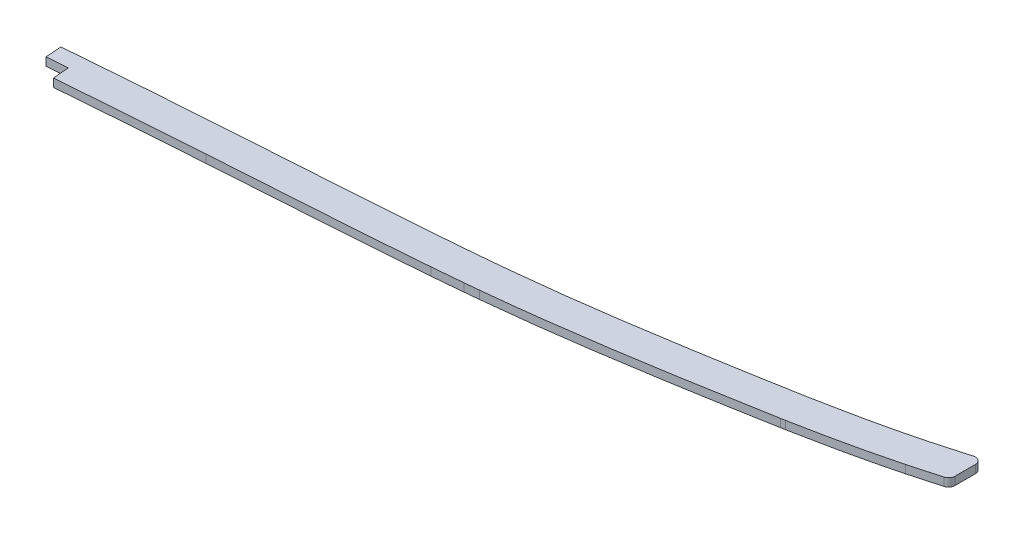
from build123d import *

# Parameters (mm, degrees)
BOSS_EXTRUDE1_START = -1.5875
BOSS_EXTRUDE1_DEPTH = 3.175
FILLET1_R           = 2.54
CUT_EXTRUDE1_DEPTH  = 7.62


# Read off the part's stored shape, not the designer's step: Boss-Extrude1
with BuildPart() as part:
    # Boss-Extrude1 outline → Boss-Extrude1 (new body)
    with BuildSketch(Plane(origin=(0, 0, 0), x_dir=(1, 0, 0), z_dir=(0, 1, 0)).offset(BOSS_EXTRUDE1_START)):
        with BuildLine():
            add(Edge.make_bspline(
                [(701.573370465, -71.674259434), (702.04697488, -71.626796619), (702.961854911, -71.534187022), (704.527211696, -71.372087014), (706.256268563, -71.189411511), (708.433468196, -70.954566837), (711.038260137, -70.66442021), (715.259153852, -70.176918919), (720.517449562, -69.537326192), (728.939784684, -68.449094171), (739.471043309, -66.973596397), (752.121699379, -65.058370184), (764.774270693, -63.022725712), (775.332382372, -61.245644149), (783.768221701, -59.789793136), (790.217423582, -58.659365862), (795.556531692, -57.710632329), (799.706029598, -56.965839367), (801.743713725, -56.597532565), (802.76701547, -56.411910209)],
                knots=[1.1996e-05, 1.1996e-05, 1.1996e-05, 1.1996e-05, 0.015636808, 0.031261621, 0.046886433, 0.062511246, 0.093760871, 0.125010496, 0.187509746, 0.250008997, 0.375007497, 0.500005998, 0.625004498, 0.750002999, 0.812502249, 0.875001499, 0.93750075, 0.968750375, 1, 1, 1, 1], degree=3))
            add(Edge.make_bspline(
                [(696.057912544, -72.218303811), (696.516819195, -72.173843609), (697.434189716, -72.08448281), (698.812500771, -71.948951554), (700.191895387, -71.812223809), (701.113019016, -71.720314305), (701.573370465, -71.674259434)],
                knots=[0.000436824, 0.000436824, 0.000436824, 0.000436824, 0.250279009, 0.500121194, 0.749963378, 0.999805563, 0.999805563, 0.999805563, 0.999805563], degree=3))
            add(Edge.make_bspline(
                [(684.465771861, -73.258588893), (685.427037387, -73.178353817), (687.338409796, -73.01607439), (690.270265001, -72.757917882), (693.135698373, -72.496722872), (695.087462196, -72.311946881), (696.057912544, -72.218303811)],
                knots=[-3.996e-06, -3.996e-06, -3.996e-06, -3.996e-06, 0.249945754, 0.499895504, 0.749845254, 0.999795004, 0.999795004, 0.999795004, 0.999795004], degree=3))
            add(Edge.make_bspline(
                [(602.42420841, -79.030202072), (604.074214061, -78.917973041), (607.327656264, -78.697993222), (612.488020924, -78.352754528), (617.82142797, -77.998720132), (624.748165187, -77.541006681), (633.288768179, -76.978079707), (643.562499486, -76.293021789), (653.811394813, -75.590339748), (662.341271598, -74.981221252), (669.157253218, -74.473896148), (673.963588211, -74.106706625), (678.141033863, -73.776630779), (681.719672317, -73.486306526), (683.554235836, -73.334679882), (684.465771861, -73.258588893)],
                knots=[4.679e-06, 4.679e-06, 4.679e-06, 4.679e-06, 0.062504419, 0.125004159, 0.1875039, 0.25000364, 0.375003121, 0.500002601, 0.625002082, 0.750001563, 0.812501303, 0.875001043, 0.937500783, 0.968750654, 1.000000524, 1.000000524, 1.000000524, 1.000000524], degree=3))
            add(Edge.make_bspline(
                [(520.17866376, -85.310815783), (520.948622537, -85.247475703), (522.472990474, -85.121954498), (525.646023872, -84.860432492), (529.954540392, -84.505420462), (535.485636827, -84.050761487), (540.7029418, -83.623505808), (545.828810606, -83.207047886), (550.972711882, -82.793890253), (556.116782859, -82.386921041), (562.976897794, -81.853433898), (571.571389273, -81.203899916), (581.568137842, -80.474939815), (590.024015055, -79.880194977), (597.052441707, -79.396103056), (600.639671821, -79.151478022), (602.42420841, -79.030202072)],
                knots=[1.3823e-05, 1.3823e-05, 1.3823e-05, 1.3823e-05, 0.031263258, 0.062512694, 0.125011564, 0.187510435, 0.250009305, 0.312508176, 0.375007046, 0.437505917, 0.500004787, 0.625002528, 0.750000269, 0.87499801, 0.937496881, 0.999995751, 0.999995751, 0.999995751, 0.999995751], degree=3))
            add(Edge.make_bspline(
                [(421.564796931, -90.347249187), (422.61109619, -90.324190198), (424.721066812, -90.275643156), (427.781390104, -90.199626606), (430.822063258, -90.118782847), (434.941029322, -90.002532976), (440.08484045, -89.844168641), (452.427619866, -89.421521336), (466.822115937, -88.804267378), (483.25535308, -87.910089241), (493.52068453, -87.276342604), (501.726177762, -86.718361924), (507.872215251, -86.275368153), (512.780927318, -85.902800926), (516.950869137, -85.573515025), (519.108912611, -85.398645627), (520.17866376, -85.310815783)],
                knots=[7.203e-06, 7.203e-06, 7.203e-06, 7.203e-06, 0.031256675, 0.062506146, 0.093755618, 0.125005089, 0.187504032, 0.250002975, 0.499998747, 0.624996633, 0.749994519, 0.812493462, 0.874992405, 0.937491348, 0.968740819, 0.999990291, 0.999990291, 0.999990291, 0.999990291], degree=3))
            add(Edge.make_bspline(
                [(346.714675087, -91.169822314), (347.184634959, -91.179549272), (348.149283989, -91.198362445), (349.881001429, -91.228640124), (351.370820969, -91.250109563), (353.638345707, -91.276445536), (356.741777131, -91.30289862), (360.603346067, -91.318288447), (365.253131479, -91.312388009), (369.910166762, -91.284169995), (376.135587827, -91.222367993), (383.937832745, -91.109503558), (391.757720532, -90.96544109), (398.23665113, -90.836219907), (403.230594411, -90.734014325), (408.182903858, -90.630969164), (412.914025095, -90.531986169), (416.611599734, -90.454119205), (419.474951766, -90.392792196), (420.864689854, -90.36259776), (421.564796931, -90.347249187)],
                knots=[1.1e-08, 1.1e-08, 1.1e-08, 1.1e-08, 0.015624829, 0.031249657, 0.062499315, 0.093748972, 0.12499863, 0.187497945, 0.24999726, 0.312496575, 0.37499589, 0.49999452, 0.62499315, 0.687492464, 0.749991779, 0.812491094, 0.874990409, 0.937489724, 0.968739382, 0.999989039, 0.999989039, 0.999989039, 0.999989039], degree=3))
            add(Edge.make_bspline(
                [(284.660180705, -86.02436228), (285.273667186, -86.114656759), (286.466569449, -86.288293963), (288.463107874, -86.571590524), (290.46491743, -86.848444068), (293.02699573, -87.19252046), (296.252166304, -87.606710304), (301.400962421, -88.226261718), (307.844767088, -88.921476193), (315.590478493, -89.626291032), (322.05207179, -90.106744711), (327.225920355, -90.425587153), (330.470644664, -90.599377294), (333.059733967, -90.723413499), (335.02192621, -90.809363102), (336.835778016, -90.883623075), (338.1694462, -90.935956115), (339.489700776, -90.98142965), (341.397886756, -91.039617592), (343.443225624, -91.094945655), (345.255837503, -91.138480537), (346.23440638, -91.159881953), (346.714675087, -91.169822314)],
                knots=[0, 0, 0, 0, 0.03125, 0.0625, 0.09375, 0.125, 0.1875, 0.25, 0.375, 0.5, 0.625, 0.6875, 0.75, 0.78125, 0.8125, 0.84375, 0.875, 0.90625, 0.9375, 0.96875, 0.984375, 1, 1, 1, 1], degree=3))
            add(Edge.make_bspline(
                [(258.083552795, -81.475395447), (258.347968296, -81.526862936), (258.876883054, -81.629439687), (259.670508063, -81.782232521), (260.729004783, -81.984533344), (265.19336261, -82.828339408), (273.252215122, -84.264018509), (280.795301047, -85.455519597), (284.660180705, -86.02436228)],
                knots=[0.425011658, 0.425011658, 0.425011658, 0.425011658, 0.442241189, 0.459470721, 0.476700252, 0.511159315, 0.75, 1, 1, 1, 1], degree=3))
            Line((258.083552795, -81.475395447), (258.083552795, -94.40861288))
            add(Edge.make_bspline(
                [(282.810885884, -98.588999508), (274.906267762, -97.425577983), (267.032082315, -96.096692803), (258.818160589, -94.548151889), (258.450825612, -94.478551371), (258.083552795, -94.40861288)],
                knots=[0, 0, 0, 0, 0.5, 0.5, 0.523411439, 0.523411439, 0.523411439, 0.523411439], degree=3))
            add(Edge.make_bspline(
                [(282.810885884, -98.588999508), (283.589001764, -98.703524555), (285.164508504, -98.932181064), (287.829592849, -99.306686744), (290.382113422, -99.652796041), (292.96654593, -99.989964246), (295.582618612, -100.317621114), (298.230083081, -100.634886778), (300.908649594, -100.941019762), (303.61800528, -101.235303734), (306.357810596, -101.517085869), (309.127700691, -101.785780175), (311.92729165, -102.040857239), (316.290106771, -102.412643883), (322.527800913, -102.877083333), (328.625603501, -103.227822262), (333.380129051, -103.452212237), (336.816790701, -103.594408746), (339.260438836, -103.686034081), (343.688375923, -103.809905452), (346.451873128, -103.867102934)],
                knots=[0, 0, 0, 0, 0.039344948, 0.07917436, 0.119484401, 0.160271019, 0.201529957, 0.243256752, 0.285446746, 0.328095093, 0.37119677, 0.414746584, 0.458739194, 0.503169123, 0.620303495, 0.752369719, 0.789892337, 0.843756099, 0.913843268, 1, 1, 1, 1], degree=3))
            add(Edge.make_bspline(
                [(346.451873128, -103.867102934), (347.517721695, -103.889163254), (349.542313965, -103.92559437), (351.410670783, -103.951601003), (353.733077388, -103.97802022), (356.595805361, -104.001616052), (359.303450326, -104.013254143), (361.856652408, -104.015647305), (363.59855953, -104.013876583), (367.980988834, -104.00146953), (374.772600805, -103.943346872), (385.553908564, -103.787153573), (397.279033824, -103.561287268), (410.957604412, -103.27591363), (418.412993695, -103.119398813), (421.843885938, -103.044182276)],
                knots=[0, 0, 0, 0, 0.033933195, 0.066295354, 0.097094988, 0.12634023, 0.180197875, 0.204824218, 0.227923989, 0.249502809, 0.379187752, 0.498147003, 0.678500622, 0.845778388, 1, 1, 1, 1], degree=3))
            add(Edge.make_bspline(
                [(421.843885938, -103.044182276), (423.284501257, -103.01243375), (426.138074601, -102.945774905), (430.23392379, -102.840101392), (434.371968877, -102.72425222), (439.798819101, -102.559925422), (448.025157593, -102.283759658), (459.021003941, -101.848637215), (471.45249354, -101.271082202), (483.913686147, -100.593406887), (494.231772367, -99.956980278), (502.466387344, -99.39745886), (508.578998405, -98.957752379), (514.573610191, -98.503827918), (518.958126171, -98.153760061), (521.218891036, -97.968142841)],
                knots=[0, 0, 0, 0, 0.042442699, 0.084473439, 0.126075796, 0.167232557, 0.248140272, 0.374197286, 0.498957981, 0.623287397, 0.750390596, 0.810583593, 0.872090979, 0.935130561, 1, 1, 1, 1], degree=3))
            add(Edge.make_bspline(
                [(521.218891036, -97.968142841), (523.451350188, -97.784491424), (528.137879673, -97.397889698), (536.731309482, -96.690817555), (544.954460679, -96.018267543), (553.50407331, -95.33057133), (563.716480518, -94.531063336), (575.636513939, -93.635190253), (588.786212869, -92.692538058), (598.347131864, -92.036570917), (603.285671904, -91.700951094)],
                knots=[0, 0, 0, 0, 0.091538543, 0.187736577, 0.288050862, 0.392265043, 0.500367872, 0.66142166, 0.827962884, 1, 1, 1, 1], degree=3))
            add(Edge.make_bspline(
                [(603.285671904, -91.700951094), (605.78808228, -91.530743591), (610.897032353, -91.186403467), (619.306599861, -90.627823918), (627.538601032, -90.084789882), (635.936476676, -89.530098998), (643.719546666, -89.009847824), (650.893783861, -88.520535985), (657.46530725, -88.061941255), (664.220349455, -87.576914876), (671.158631923, -87.060362733), (677.768426526, -86.549575155), (682.892578542, -86.13408317), (685.522190682, -85.9145748)],
                knots=[0, 0, 0, 0, 0.096041268, 0.194096291, 0.29416615, 0.396252661, 0.500358628, 0.578021943, 0.657927659, 0.740076076, 0.824468696, 0.911108458, 1, 1, 1, 1], degree=3))
            add(Edge.make_bspline(
                [(685.522190682, -85.9145748), (686.483363358, -85.834347474), (688.416317483, -85.670266195), (691.375399642, -85.409794673), (694.295027309, -85.143745348), (696.281480154, -84.95572275), (697.280162315, -84.859352478)],
                knots=[0, 0, 0, 0, 0.247890437, 0.497182912, 0.747883707, 1, 1, 1, 1], degree=3))
            add(Edge.make_bspline(
                [(697.280162315, -84.859352478), (699.133498258, -84.679799353), (700.986276607, -84.496390936), (702.838684367, -84.311070025)],
                knots=[0, 0, 0, 0, 1, 1, 1, 1], degree=3))
            add(Edge.make_bspline(
                [(702.838684367, -84.311070025), (703.589775295, -84.235799752), (705.133492987, -84.078629058), (708.047466313, -83.771407142), (710.748991263, -83.476233306), (713.523455705, -83.162791229), (716.37085234, -82.830812164), (719.291149506, -82.479719712), (722.284334057, -82.109050619), (725.350396028, -81.718303946), (730.760173437, -81.009658613), (740.331799838, -79.683632118), (753.598097399, -77.68903736), (767.27468421, -75.481732644), (778.677358422, -73.559116698), (788.170711893, -71.915943965), (796.891357387, -70.375844053), (802.366731643, -69.391771369), (805.033747795, -68.907986576)],
                knots=[0, 0, 0, 0, 0.024848372, 0.050416521, 0.076704883, 0.103713975, 0.131444397, 0.159896834, 0.189072062, 0.218970945, 0.249594443, 0.347406526, 0.499390399, 0.638902952, 0.749436379, 0.834969029, 0.918499168, 1, 1, 1, 1], degree=3))
            Line((805.033747795, -68.907986576), (806.809551789, -68.578936168))
            add(Edge.make_bspline(
                [(806.809551789, -68.578936168), (807.794004822, -68.395119755), (809.726191369, -68.029713589), (811.766757719, -67.634799792), (814.185248792, -67.158567155), (816.55886725, -66.68111941), (820.369254046, -65.898841142), (824.807312319, -64.951185469), (829.827239229, -63.826217582), (833.268092373, -63.026324522), (835.935211118, -62.389425037), (837.873162846, -61.91853539), (839.769381429, -61.449895816), (841.624127129, -60.983575945), (843.734931971, -60.443149682), (844.733875611, -60.183258894), (845.223156672, -60.055102096)],
                knots=[0, 0, 0, 0, 0.064848776, 0.128591831, 0.191223632, 0.252742215, 0.313148507, 0.487734154, 0.598660779, 0.705288655, 0.75701083, 0.807682273, 0.85731034, 0.905901891, 0.953463218, 1, 1, 1, 1], degree=3))
            add(Edge.make_bspline(
                [(858.805970467, -56.257210913), (854.302265416, -57.602424975), (849.773135735, -58.863331563), (845.223156672, -60.055102096)],
                knots=[0.525572557, 0.525572557, 0.525572557, 0.525572557, 1, 1, 1, 1], degree=3))
            Line((858.805970467, -56.257210913), (858.805970467, -42.981654463))
            add(Edge.make_bspline(
                [(842.005216089, -47.769547229), (844.33209519, -47.160070589), (848.630876213, -45.996859499), (853.420502494, -44.614540459), (856.161610787, -43.791878163), (857.220661541, -43.470009626), (858.013965236, -43.226852548), (858.542087125, -43.063586295), (858.805970467, -42.981654463)],
                knots=[0, 0, 0, 0, 0.25, 0.462204418, 0.52007177, 0.549005446, 0.577939123, 0.606872799, 0.606872799, 0.606872799, 0.606872799], degree=3))
            add(Edge.make_bspline(
                [(804.478503109, -56.094697623), (804.937261418, -56.009038578), (805.873535899, -55.833158182), (807.593890186, -55.506511486), (809.223478159, -55.191529302), (811.577863033, -54.728351346), (814.728198308, -54.095426794), (818.65467417, -53.281335813), (823.355137668, -52.264852214), (828.043123472, -51.207419322), (831.9339187, -50.292144023), (835.047083584, -49.53591133), (836.970069876, -49.058975401), (838.551971708, -48.659746263), (839.885294081, -48.319263071), (841.0585054, -48.016793361), (841.676038434, -47.855768334), (842.005216089, -47.769547229)],
                knots=[0, 0, 0, 0, 0.03125, 0.0625, 0.125, 0.1875, 0.25, 0.375, 0.5, 0.625, 0.75, 0.8125, 0.875, 0.90625, 0.9375, 0.96875, 1, 1, 1, 1], degree=3))
            Line((804.478503109, -56.094697623), (802.76701547, -56.411910209))
        make_face()
    extrude(amount=BOSS_EXTRUDE1_DEPTH)

    # Fillet1
    fillet1_edges = [part.edges().sort_by_distance(p)[0] for p in [
        (858.805970467, 0, 42.981654463),
        (858.805970467, 0, 56.257210913),
        (258.083552795, 0, 81.475395447),
        (258.083552795, 0, 94.40861288),
    ]]
    fillet(fillet1_edges, radius=FILLET1_R)

    # Sketch3 → Cut-Extrude1 (cut)
    with BuildSketch(Plane(origin=(0, 1.5875, 0), x_dir=(1, 0, 0), z_dir=(0, 1, 0))):
        with BuildLine():
            Line((538.573908081, -83.797990994), (539.029351184, -90.069007907))
            Line((539.029351184, -90.069007907), (547.151700891, -89.47910866))
            Line((547.151700891, -89.47910866), (547.661463933, -95.801226886))
            add(Edge.make_bspline(
                [(521.218891036, -97.968142841), (523.451350188, -97.784491424), (528.137879673, -97.397889698), (536.731309482, -96.690817555), (543.042562143, -96.17463672), (546.723612796, -95.876847403), (547.661463933, -95.801226886)],
                knots=[0, 0, 0, 0, 0.091538543, 0.187736577, 0.288050862, 0.322345551, 0.322345551, 0.322345551, 0.322345551], degree=3))
            add(Edge.make_bspline(
                [(421.843885938, -103.044182276), (423.284501257, -103.01243375), (426.138074601, -102.945774905), (430.23392379, -102.840101392), (434.371968877, -102.72425222), (439.798819101, -102.559925422), (448.025157593, -102.283759658), (459.021003941, -101.848637215), (471.45249354, -101.271082202), (483.913686147, -100.593406887), (494.231772367, -99.956980278), (502.466387344, -99.39745886), (508.578998405, -98.957752379), (514.573610191, -98.503827918), (518.958126171, -98.153760061), (521.218891036, -97.968142841)],
                knots=[0, 0, 0, 0, 0.042442699, 0.084473439, 0.126075796, 0.167232557, 0.248140272, 0.374197286, 0.498957981, 0.623287397, 0.750390596, 0.810583593, 0.872090979, 0.935130561, 1, 1, 1, 1], degree=3))
            add(Edge.make_bspline(
                [(346.451873128, -103.867102934), (347.517721695, -103.889163254), (349.542313965, -103.92559437), (351.410670783, -103.951601003), (353.733077388, -103.97802022), (356.595805361, -104.001616052), (359.303450326, -104.013254143), (361.856652408, -104.015647305), (363.59855953, -104.013876583), (367.980988834, -104.00146953), (374.772600805, -103.943346872), (385.553908564, -103.787153573), (397.279033824, -103.561287268), (410.957604412, -103.27591363), (418.412993695, -103.119398813), (421.843885938, -103.044182276)],
                knots=[0, 0, 0, 0, 0.033933195, 0.066295354, 0.097094988, 0.12634023, 0.180197875, 0.204824218, 0.227923989, 0.249502809, 0.379187752, 0.498147003, 0.678500622, 0.845778388, 1, 1, 1, 1], degree=3))
            add(Edge.make_bspline(
                [(282.810885884, -98.588999508), (283.589001764, -98.703524555), (285.164508504, -98.932181064), (287.829592849, -99.306686744), (290.382113422, -99.652796041), (292.96654593, -99.989964246), (295.582618612, -100.317621114), (298.230083081, -100.634886778), (300.908649594, -100.941019762), (303.61800528, -101.235303734), (306.357810596, -101.517085869), (309.127700691, -101.785780175), (311.92729165, -102.040857239), (316.290106771, -102.412643883), (322.527800913, -102.877083333), (328.625603501, -103.227822262), (333.380129051, -103.452212237), (336.816790701, -103.594408746), (339.260438836, -103.686034081), (343.688375923, -103.809905452), (346.451873128, -103.867102934)],
                knots=[0, 0, 0, 0, 0.039344948, 0.07917436, 0.119484401, 0.160271019, 0.201529957, 0.243256752, 0.285446746, 0.328095093, 0.37119677, 0.414746584, 0.458739194, 0.503169123, 0.620303495, 0.752369719, 0.789892337, 0.843756099, 0.913843268, 1, 1, 1, 1], degree=3))
            add(Edge.make_bspline(
                [(260.156933678, -94.799777019), (267.681906669, -96.206087709), (275.23240977, -97.473589286), (282.810885884, -98.588999508)],
                knots=[0, 0, 0, 0, 0.479370069, 0.479370069, 0.479370069, 0.479370069], degree=3))
            ThreePointArc((260.156933678, -94.799777019), (258.66947298, -93.925704756), (258.083552795, -92.302978906))
            Line((258.083552795, -92.302978906), (258.083552795, -84.549365422))
            ThreePointArc((258.083552795, -84.549365422), (259.00311997, -82.593400837), (261.09599174, -82.053688872))
            add(Edge.make_bspline(
                [(284.660180705, -86.02436228), (280.795301047, -85.455519597), (273.252215122, -84.264018509), (265.404390098, -82.865933811), (261.414911279, -82.114061283), (261.09599174, -82.053688872)],
                knots=[0.490403274, 0.490403274, 0.490403274, 0.490403274, 0.740403274, 0.979243959, 1, 1, 1, 1], degree=3))
            add(Edge.make_bspline(
                [(346.714674129, -91.169822295), (346.23440638, -91.159881953), (345.255837503, -91.138480537), (343.443225624, -91.094945655), (341.397886756, -91.039617592), (339.489700776, -90.98142965), (338.1694462, -90.935956115), (336.835778016, -90.883623075), (335.02192621, -90.809363102), (333.059733967, -90.723413499), (330.470644664, -90.599377294), (327.225920355, -90.425587153), (322.05207179, -90.106744711), (315.590478493, -89.626291032), (307.844767088, -88.921476193), (301.400962421, -88.226261718), (296.252166304, -87.606710304), (293.02699573, -87.19252046), (290.46491743, -86.848444068), (288.463107874, -86.571590524), (286.466569449, -86.288293963), (285.273667186, -86.114656759), (284.660180705, -86.02436228)],
                knots=[2.1e-08, 2.1e-08, 2.1e-08, 2.1e-08, 0.015625, 0.03125, 0.0625, 0.09375, 0.125, 0.15625, 0.1875, 0.21875, 0.25, 0.3125, 0.375, 0.5, 0.625, 0.75, 0.8125, 0.875, 0.90625, 0.9375, 0.96875, 1, 1, 1, 1], degree=3))
            add(Edge.make_bspline(
                [(421.564796931, -90.347249187), (420.864689854, -90.36259776), (419.474951766, -90.392792196), (416.611599734, -90.454119205), (412.914025095, -90.531986169), (408.182903858, -90.630969164), (403.230594411, -90.734014325), (398.23665113, -90.836219907), (391.757720532, -90.96544109), (383.937832745, -91.109503558), (376.135587827, -91.222367993), (369.910166762, -91.284169995), (365.253131479, -91.312388009), (360.603346067, -91.318288447), (356.741777131, -91.30289862), (353.638345707, -91.276445536), (351.370820969, -91.250109563), (349.881001429, -91.228640124), (348.149283695, -91.19836244), (347.184634303, -91.17954926), (346.714674129, -91.169822295)],
                knots=[0, 0, 0, 0, 0.031249657, 0.062499315, 0.12499863, 0.187497945, 0.24999726, 0.312496575, 0.37499589, 0.49999452, 0.62499315, 0.687492464, 0.749991779, 0.812491094, 0.874990409, 0.906240067, 0.937489724, 0.968739382, 0.984364211, 0.999989039, 0.999989039, 0.999989039, 0.999989039], degree=3))
            add(Edge.make_bspline(
                [(520.17866376, -85.310815783), (519.108912611, -85.398645627), (516.950869137, -85.573515025), (512.780927318, -85.902800926), (507.872215251, -86.275368153), (501.726177762, -86.718361924), (493.52068453, -87.276342604), (483.25535308, -87.910089241), (466.822115937, -88.804267378), (452.427619866, -89.421521336), (440.08484045, -89.844168641), (434.941029322, -90.002532976), (430.822063258, -90.118782847), (427.781390104, -90.199626606), (424.721066812, -90.275643156), (422.61109619, -90.324190198), (421.564796931, -90.347249187)],
                knots=[7.203e-06, 7.203e-06, 7.203e-06, 7.203e-06, 0.031256675, 0.062506146, 0.125005089, 0.187504032, 0.250002975, 0.375000861, 0.499998747, 0.749994519, 0.812493462, 0.874992405, 0.906241876, 0.937491348, 0.968740819, 0.999990291, 0.999990291, 0.999990291, 0.999990291], degree=3))
            add(Edge.make_bspline(
                [(538.573908081, -83.797990994), (537.540297953, -83.882548181), (534.735644037, -84.112411281), (529.954540392, -84.505420462), (525.646023872, -84.860432492), (522.472990474, -85.121954498), (520.948622537, -85.247475703), (520.17866376, -85.310815783)],
                knots=[0.775424, 0.775424, 0.775424, 0.775424, 0.81249914, 0.87499801, 0.937496881, 0.968746316, 0.999995751, 0.999995751, 0.999995751, 0.999995751], degree=3))
        make_face()
    extrude(amount=-CUT_EXTRUDE1_DEPTH, mode=Mode.SUBTRACT)


with BuildPart() as cut_extrude1_kept_piece:
    # of the separate pieces the step leaves, the one the design keeps (cut_extrude1_pieces_kept)
    add(part.part.solids().sort_by_distance((855.536472896, -1.5875, 43.979149832))[0])


solid = cut_extrude1_kept_piece.part
